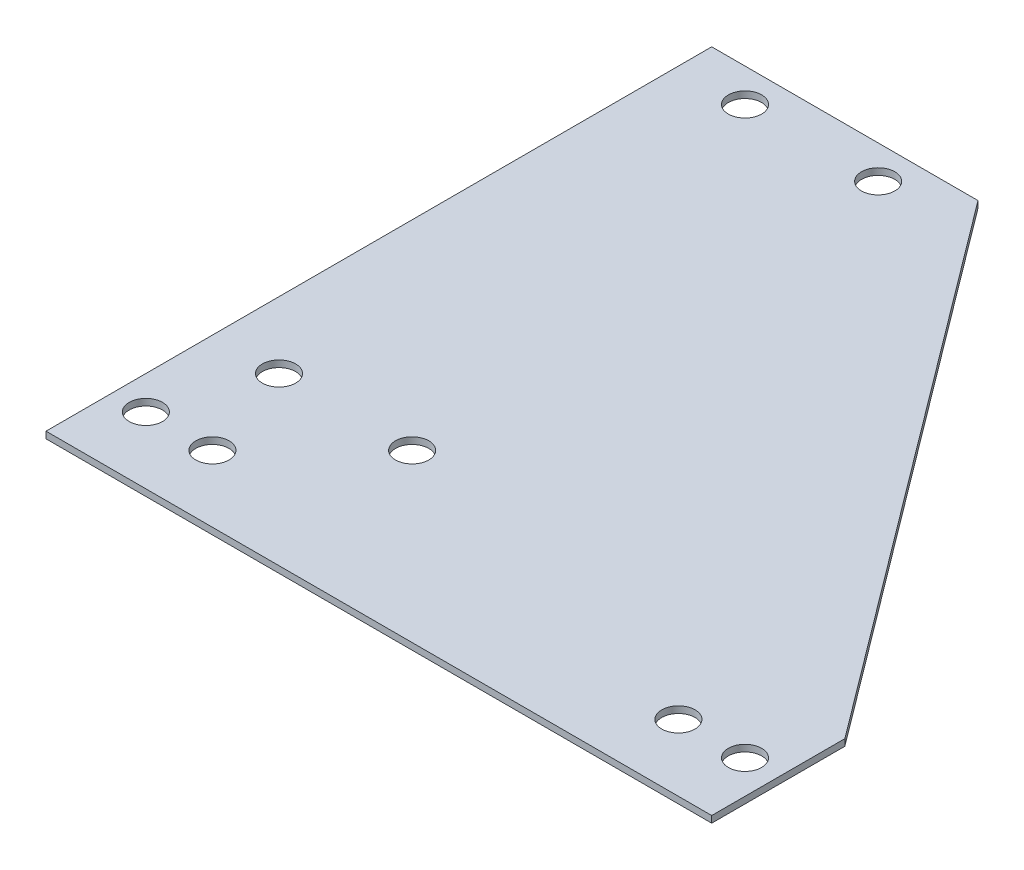
from build123d import *

# Parameters (mm, degrees)
SKETCH1_R           = 2.5
BOSS_EXTRUDE1_DEPTH = 1


with BuildPart() as part:
    # Sketch1 → Boss-Extrude1 (new body)
    with BuildSketch(Plane(origin=(0, 0, 0), x_dir=(1, 0, 0), z_dir=(0, 1, 0))):
        Polygon((0, 0), (0, -100), (100, -100), (100, -80), (40, 0), align=None)
        with Locations((10, -5)):
            Circle(SKETCH1_R, mode=Mode.SUBTRACT)
        with Locations((30, -5)):
            Circle(SKETCH1_R, mode=Mode.SUBTRACT)
        with Locations((85, -90)):
            Circle(SKETCH1_R, mode=Mode.SUBTRACT)
        with Locations((95, -90)):
            Circle(SKETCH1_R, mode=Mode.SUBTRACT)
        with Locations((30, -75)):
            Circle(SKETCH1_R, mode=Mode.SUBTRACT)
        with Locations((10, -75)):
            Circle(SKETCH1_R, mode=Mode.SUBTRACT)
        with Locations((5, -90)):
            Circle(SKETCH1_R, mode=Mode.SUBTRACT)
        with Locations((15, -90)):
            Circle(SKETCH1_R, mode=Mode.SUBTRACT)
    extrude(amount=BOSS_EXTRUDE1_DEPTH)


solid = part.part
